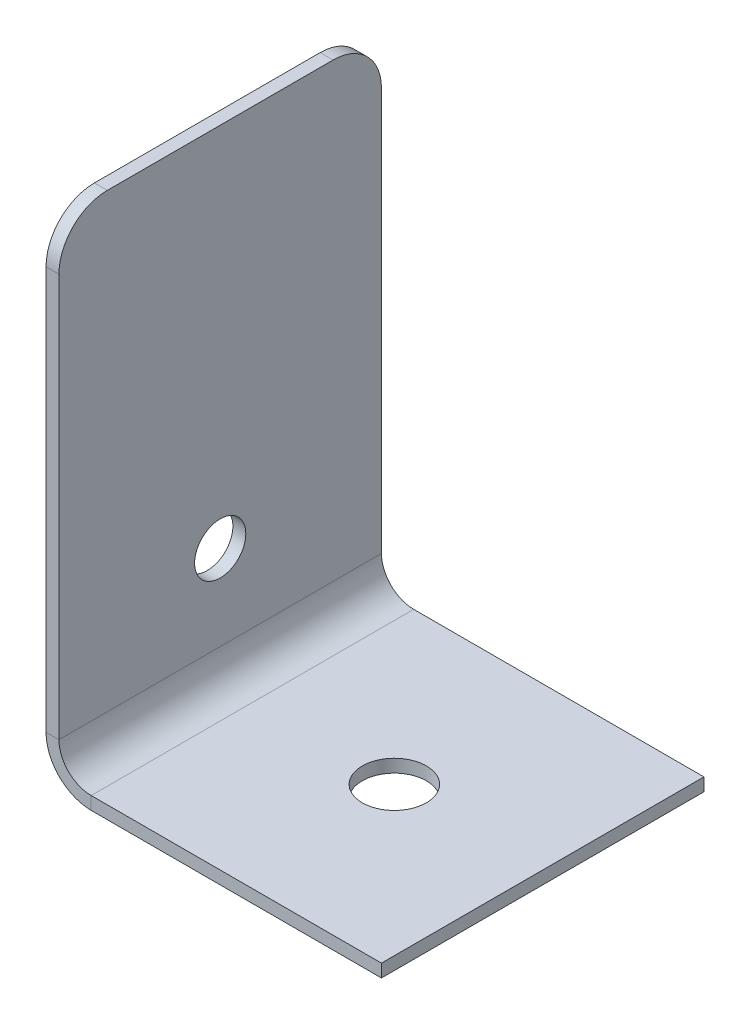
from build123d import *

# Parameters (mm, degrees)
BASE_FLANGE1_DEPTH      = 10
BASE_FLANGE1_DEPTH_BACK = 10
SKETCH2_R               = 1.5875
CUT_EXTRUDE1_DEPTH      = 38.416573868
SKETCH3_R               = 1.984375
CUT_EXTRUDE2_DEPTH      = 10
FILLET1_R               = 3


# Sheet-metal steps are written as plain solids
with BuildPart() as part:
    # Sketch1 → Base-Flange1 (new, two sides: drawn at the far end of the back side and taken through both)
    with BuildSketch(Plane.XY.offset(-BASE_FLANGE1_DEPTH_BACK)):
        with BuildLine():
            Line((0, 30), (0, 2))
            ThreePointArc((0, 2), (0.585786438, 0.585786438), (2, 0))
            Line((2, 0), (20, 0))
            Line((20, 0), (20, -0.8))
            Line((20, -0.8), (2, -0.8))
            ThreePointArc((2, -0.8), (0.020101013, 0.020101013), (-0.8, 2))
            Line((-0.8, 2), (-0.8, 30))
            Line((-0.8, 30), (0, 30))
        make_face()
    extrude(amount=BASE_FLANGE1_DEPTH + BASE_FLANGE1_DEPTH_BACK)

    # Sketch2 → Cut-Extrude1 (cut, through all)
    with BuildSketch(Plane(origin=(0, 0, 0), x_dir=(0, 0, -1), z_dir=(1, 0, 0))):
        with Locations(Location((0, 7.27, 0), (0, 0, 90))):
            Circle(SKETCH2_R)
    extrude(amount=-CUT_EXTRUDE1_DEPTH, mode=Mode.SUBTRACT)

    # Sketch3 → Cut-Extrude2 (cut)
    with BuildSketch(Plane(origin=(0, 0, 0), x_dir=(1, 0, 0), z_dir=(0, 1, 0))):
        with Locations(Location((10.8, 0, 0), (0, 0, 270))):
            Circle(SKETCH3_R)
    extrude(amount=-CUT_EXTRUDE2_DEPTH, mode=Mode.SUBTRACT)

    # Fillet1
    fillet1_edges = [part.edges().sort_by_distance(p)[0] for p in [
        (-0.4, 30, 10),
        (-0.4, 30, -10),
    ]]
    fillet(fillet1_edges, radius=FILLET1_R)


solid = part.part
